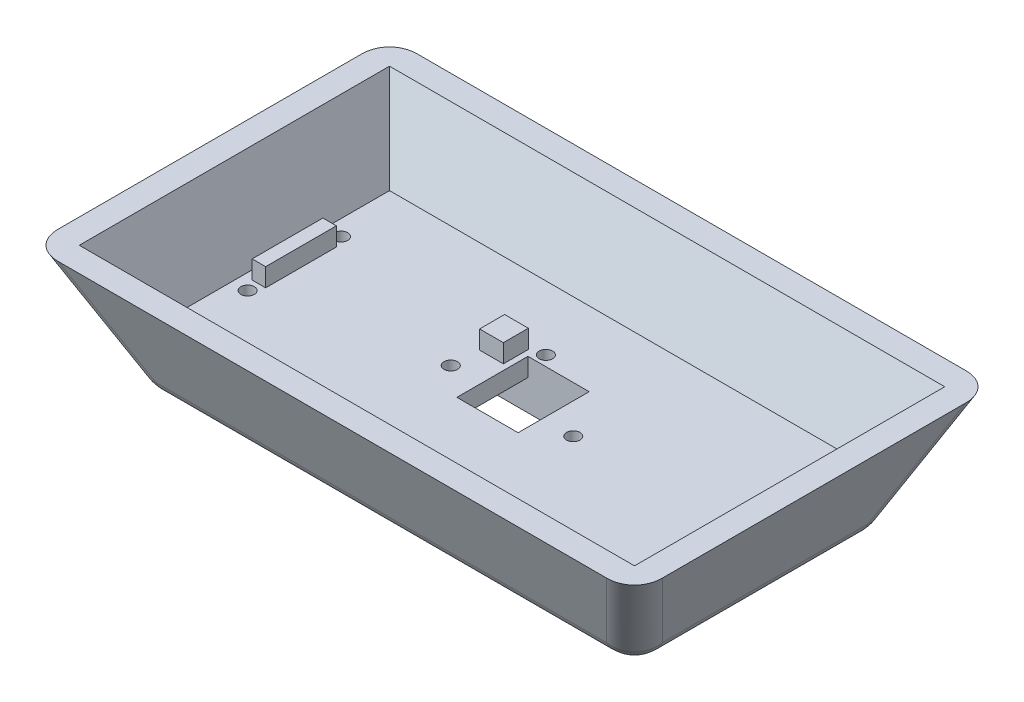
from build123d import *

# Parameters (mm, degrees)
SKETCH1_W           = 80
SKETCH1_H           = 40
BOSS_EXTRUDE1_DEPTH = 20
BOSS_EXTRUDE1_DRAFT = -25
SKETCH2_W           = 30.2
SKETCH2_H           = 15.2
CUT_EXTRUDE1_DEPTH  = 5
SKETCH3_W           = 90.652306326
SKETCH3_H           = 50.652306326
CUT_EXTRUDE3_DEPTH  = 12
CUT_EXTRUDE3_DRAFT  = -25
CUT_EXTRUDE4_REACH  = 61.314
SKETCH5_R           = 1.1
SKETCH5_W           = 10
SKETCH5_H           = 11.6
SKETCH6_R           = 1.1
CUT_EXTRUDE5_DEPTH  = 4.75
SKETCH7_W           = 2.2
SKETCH7_H           = 11.55
SKETCH7_W_2         = 3.881780026
SKETCH7_H_2         = 4.079158671
BOSS_EXTRUDE3_DEPTH = 3
FILLET1_R           = 5


with BuildPart() as part:
    # Sketch1 → Boss-Extrude1 (with draft: the straight prism first)
    with BuildSketch(Plane(origin=(0, 0, 0), x_dir=(1, 0, 0), z_dir=(0, 1, 0))):
        Rectangle(SKETCH1_W, SKETCH1_H)
    extrude(amount=BOSS_EXTRUDE1_DEPTH)
    # Boss-Extrude1: the draft: its side faces are tilted about the plane it starts from
    boss_extrude1_sides = [part.faces().sort_by_distance(p)[0] for p in [
        (-40, 10, 0),
        (0, 10, 20),
        (40, 10, 0),
        (0, 10, -20),
    ]]
    draft(boss_extrude1_sides, Plane(origin=(0, 0, 0), x_dir=(1, 0, 0), z_dir=(0, 1, 0)), BOSS_EXTRUDE1_DRAFT)

    # Sketch2 → Cut-Extrude1 (cut)
    with BuildSketch(Plane.XZ):
        Rectangle(SKETCH2_W, SKETCH2_H)
    extrude(amount=-CUT_EXTRUDE1_DEPTH, mode=Mode.SUBTRACT)


with BuildPart() as cut_extrude3_tool:
    # Sketch3 → Cut-Extrude3 (with draft: the straight prism first)
    with BuildSketch(Plane(origin=(0, 20, 0), x_dir=(1, 0, 0), z_dir=(0, 1, 0))):
        Rectangle(SKETCH3_W, SKETCH3_H)
    extrude(amount=-CUT_EXTRUDE3_DEPTH)
    # Cut-Extrude3: the draft: its side faces are tilted about the plane it starts from
    cut_extrude3_sides = [cut_extrude3_tool.faces().sort_by_distance(p)[0] for p in [
        (-45.326153163, 14, 0),
        (0, 14, 25.326153163),
        (45.326153163, 14, 0),
        (0, 14, -25.326153163),
    ]]
    draft(cut_extrude3_sides, Plane(origin=(0, 20, 0), x_dir=(1, 0, 0), z_dir=(0, 1, 0)), CUT_EXTRUDE3_DRAFT)


with BuildPart() as part_1:
    add(part.part)

    # Cut-Extrude3: cut by cut_extrude3_tool
    add(cut_extrude3_tool.part, mode=Mode.SUBTRACT)

    # Sketch5 → Cut-Extrude4 (cut, up to next)
    with BuildSketch(Plane.XZ.offset(-5), mode=Mode.PRIVATE) as cut_extrude4_sk1:
        with Locations((-10, 0)):
            Circle(SKETCH5_R)
    cut_extrude4_tool1 = extrude(cut_extrude4_sk1.sketch, amount=-CUT_EXTRUDE4_REACH, mode=Mode.PRIVATE) & part_1.part
    # Sketch5 → Cut-Extrude4 (cut, up to next)
    with BuildSketch(Plane.XZ.offset(-5), mode=Mode.PRIVATE) as cut_extrude4_sk2:
        with Locations((10, 0)):
            Circle(SKETCH5_R)
    cut_extrude4_tool2 = extrude(cut_extrude4_sk2.sketch, amount=-CUT_EXTRUDE4_REACH, mode=Mode.PRIVATE) & part_1.part
    # Sketch5 → Cut-Extrude4 (cut, up to next)
    with BuildSketch(Plane.XZ.offset(-5), mode=Mode.PRIVATE) as cut_extrude4_sk3:
        with Locations((0, -1.8)):
            Rectangle(SKETCH5_W, SKETCH5_H)
    cut_extrude4_tool3 = extrude(cut_extrude4_sk3.sketch, amount=-CUT_EXTRUDE4_REACH, mode=Mode.PRIVATE) & part_1.part
    add(cut_extrude4_tool1.solids().sort_by_distance((-10, 5, 0))[0], mode=Mode.SUBTRACT)
    add(cut_extrude4_tool2.solids().sort_by_distance((10, 5, 0))[0], mode=Mode.SUBTRACT)
    add(cut_extrude4_tool3.solids().sort_by_distance((0, 5, -1.8))[0], mode=Mode.SUBTRACT)

    # Sketch6 → Cut-Extrude5 (cut)
    with BuildSketch(Plane(origin=(0, 8, 0), x_dir=(1, 0, 0), z_dir=(0, 1, 0))):
        with Locations((-37.190461265, -5.98)):
            Circle(SKETCH6_R)
        with Locations((-37.190461265, 9.27)):
            Circle(SKETCH6_R)
        with Locations((-3.730461265, 9.27)):
            Circle(SKETCH6_R)
    extrude(amount=-CUT_EXTRUDE5_DEPTH, mode=Mode.SUBTRACT)

    # Sketch7 → Boss-Extrude3 (add)
    with BuildSketch(Plane(origin=(0, 8, 0), x_dir=(1, 0, 0), z_dir=(0, 1, 0))):
        with Locations((-37.190461265, 1.645)):
            Rectangle(SKETCH7_W, SKETCH7_H)
        with Locations((-7.876757403, 6.569595389)):
            Rectangle(SKETCH7_W_2, SKETCH7_H_2)
    extrude(amount=BOSS_EXTRUDE3_DEPTH)

    # Fillet1
    fillet1_edges = [part_1.edges().sort_by_distance(p)[0] for p in [
        (-40, 0, 0),
        (0, 0, 20),
        (40, 0, 0),
        (0, 0, -20),
        (-44.663076582, 10, 24.663076582),
        (44.663076582, 10, 24.663076582),
        (44.663076582, 10, -24.663076582),
        (-44.663076582, 10, -24.663076582),
    ]]
    fillet(fillet1_edges, radius=FILLET1_R)


solid = part_1.part
